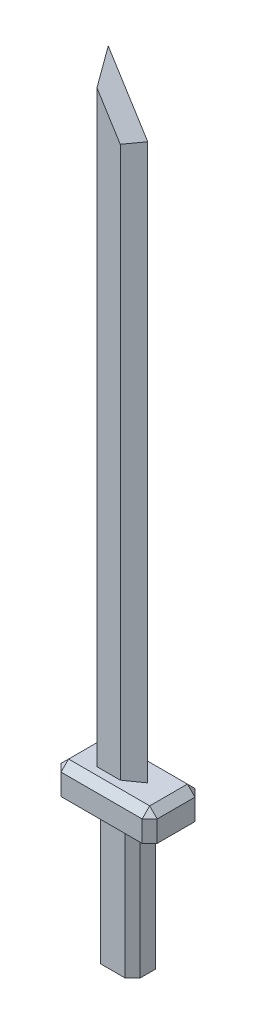
from build123d import *

# Parameters (mm, degrees)
BOSS_EXTRUDE1_DEPTH = 1.5
SKETCH1_3_W         = 5.23149294
SKETCH1_3_H         = 18.074674524
BOSS_EXTRUDE2_DEPTH = 2
SKETCH1_4_W         = 12.747878717
SKETCH1_4_H         = 3.806509515
BOSS_EXTRUDE3_DEPTH = 3.5
CHAMFER1_SIZE       = 1
CHAMFER2_SIZE       = 2.14222201
CHAMFER2_SIZE_2     = 1.5


with BuildPart() as part:
    # Sketch1 → Boss-Extrude1 (new, symmetric)
    with BuildSketch(Plane.XY):
        Polygon((0, 81.942442457), (0, 0), (5.23149294, 0), (5.23149294, 73.572714139), align=None)
    extrude(amount=BOSS_EXTRUDE1_DEPTH, both=True)



with BuildPart() as body_2:
    # Sketch1<3> → Boss-Extrude2 (new, symmetric)
    with BuildSketch(Plane.XY):
        with Locations((2.61574647, -12.843846777)):
            Rectangle(SKETCH1_3_W, SKETCH1_3_H)
    extrude(amount=BOSS_EXTRUDE2_DEPTH, both=True)


with BuildPart() as part_1:
    add(part.part)

    add(body_2.part)  # Boss-Extrude3 merges body 2
    # Sketch1<4> → Boss-Extrude3 (add, symmetric)
    with BuildSketch(Plane.XY):
        with Locations((2.615746471, -1.903254758)):
            Rectangle(SKETCH1_4_W, SKETCH1_4_H)
    extrude(amount=BOSS_EXTRUDE3_DEPTH, both=True)

    # Chamfer1
    chamfer1_edges = [part_1.edges().sort_by_distance(p)[0] for p in [
        (2.61574647, 0, 3.5),
        (8.989685829, 0, 0),
        (-3.758192888, -1.903254757, -3.5),
        (-3.758192888, 0, 0),
        (8.989685829, -1.903254757, 3.5),
        (-3.758192888, -1.903254757, 3.5),
        (2.61574647, 0, -3.5),
        (8.989685829, -1.903254757, -3.5),
        (0, -12.843846777, -2),
        (5.23149294, -12.843846777, 2),
        (0, -12.843846777, 2),
        (5.23149294, -12.843846777, -2),
    ]]
    chamfer(chamfer1_edges, length=CHAMFER1_SIZE)

    # Chamfer2
    # the kernel refuses this chamfer: 2.14222201, 1.5 mm, written as the material it takes off along each edge
    with BuildSketch(Plane(origin=(5.23149294, 0, 1.5), x_dir=(-0.99975333476413, 0, 0.022209674198456916), z_dir=(0, 1, 0))) as chamfer2_piece_1:
        Polygon((CHAMFER2_SIZE * 0.999753334817, -CHAMFER2_SIZE * 0.0222096741996), (-CHAMFER2_SIZE_2 * 0.0222096741985, -CHAMFER2_SIZE_2 * 0.999753334764), (0, 0), align=None)
    extrude(amount=79.105114369, mode=Mode.SUBTRACT)
    with BuildSketch(Plane(origin=(5.23149294, 0, -1.5), x_dir=(-0.99975333476413, 0, -0.022209674198456916), z_dir=(0, 1, 0))) as chamfer2_piece_2:
        Polygon((CHAMFER2_SIZE * 0.999753334817, CHAMFER2_SIZE * 0.0222096741996), (-CHAMFER2_SIZE_2 * 0.0222096741985, CHAMFER2_SIZE_2 * 0.999753334764), (0, 0), align=None)
    extrude(amount=79.105114369, mode=Mode.SUBTRACT)
    with BuildSketch(Plane(origin=(8.163825559, 68.881352106, 1.5), x_dir=(-0.8477703422928946, -0.5298982705204714, 0.02220967419845706), z_dir=(-0.530029010251303, 0.8479795093585836, 0))) as chamfer2_piece_3:
        Polygon((CHAMFER2_SIZE * 0.999753334817, -CHAMFER2_SIZE * 0.0222096741996), (-CHAMFER2_SIZE_2 * 0.0222096741985, -CHAMFER2_SIZE_2 * 0.999753334764), (0, 0), align=None)
    extrude(amount=20.935001598, mode=Mode.SUBTRACT)
    with BuildSketch(Plane(origin=(8.163825559, 68.881352106, -1.5), x_dir=(-0.8477703422928946, -0.5298982705204714, -0.02220967419845706), z_dir=(-0.530029010251303, 0.8479795093585836, 0))) as chamfer2_piece_4:
        Polygon((CHAMFER2_SIZE * 0.999753334817, CHAMFER2_SIZE * 0.0222096741996), (-CHAMFER2_SIZE_2 * 0.0222096741985, CHAMFER2_SIZE_2 * 0.999753334764), (0, 0), align=None)
    extrude(amount=20.935001598, mode=Mode.SUBTRACT)


solid = part_1.part
